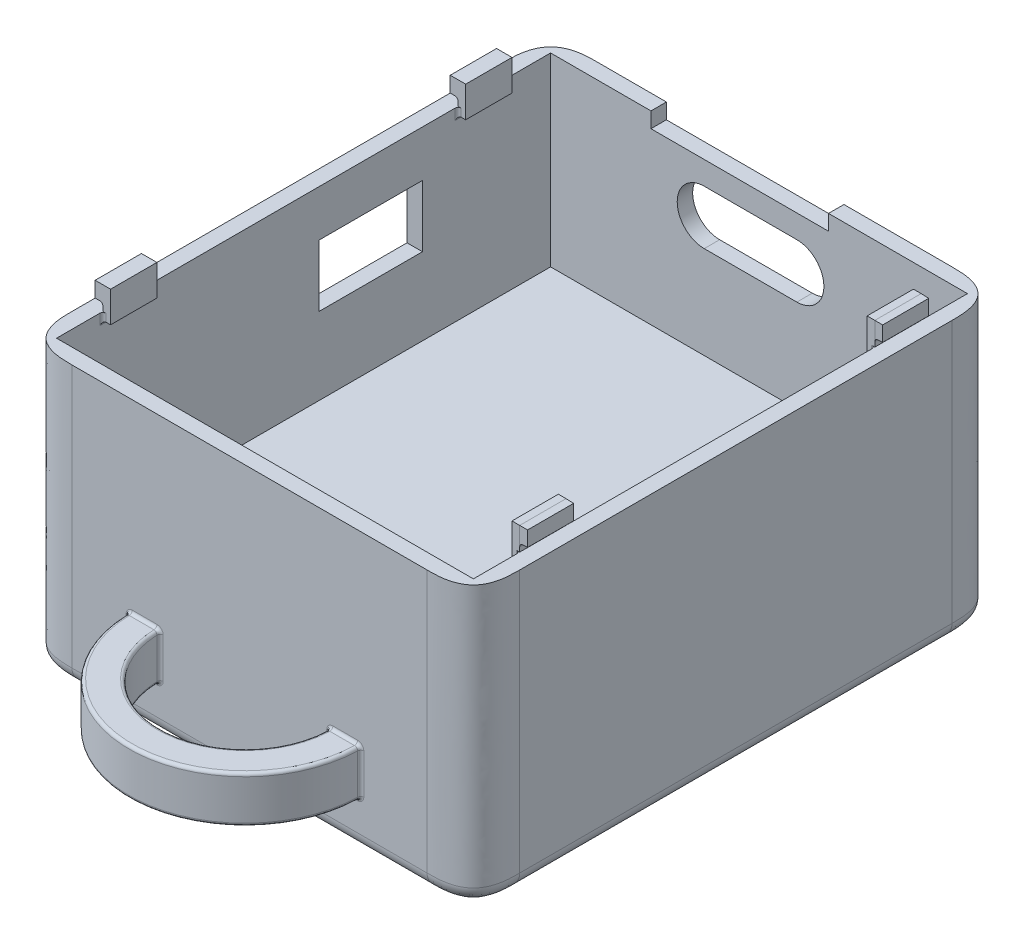
from build123d import *

# Parameters (mm, degrees)
SKETCH1_W              = 29
SKETCH1_H              = 34
BOTTOM_EXTRUDE_DEPTH   = 18
SID_CORNER_FILLET_SIZE = 3
BOTTOM_FILLET_R        = 1
SKETCH2_W              = 27
SKETCH2_H              = 32
CUT_EXTRUDE1_DEPTH     = 12
BOSS_EXTRUDE1_DEPTH    = 3
FILLET1_R              = 0.2
CUT_USB_REACH          = 157.318
SKETCH22_W             = 11.5
SKETCH22_H             = 1
SKETCH23_W             = 6.7
SKETCH23_H             = 4
CUT_BT_DEPTH           = 1
SKETCH24_W             = 3
SKETCH24_H             = 2
BOSS_CLIP_DEPTH        = 0.5
SKETCH26_W             = 3
SKETCH26_H             = 1
BOSS_CLIPEXT_DEPTH     = 0.5
BOSS_CLIPEXT_TAPER     = 1
FILLET2_R              = 0.2
LPATTERN2_COUNT        = 2
LPATTERN2_PITCH        = 23
FILLET2_OF_LPATTERN2_R = 0.2
SKETCH27_W             = 3
SKETCH27_H             = 2
BOSS_CLIP1_DEPTH       = 0.5
SKETCH28_W             = 3
SKETCH28_H             = 1
BOSS_CLIPEXT1_DEPTH    = 0.5
FILLET4_R              = 0.2
LPATTERN4_COUNT        = 2
LPATTERN4_PITCH        = 23
FILLET4_OF_LPATTERN4_R = 0.2


with BuildPart() as part:
    # Sketch1 → Bottom-Extrude (new body)
    with BuildSketch(Plane(origin=(0, 0, 0), x_dir=(1, 0, 0), z_dir=(0, 1, 0))):
        with Locations((-134.084269663, 79.775280899)):
            Rectangle(SKETCH1_W, SKETCH1_H)
    extrude(amount=BOTTOM_EXTRUDE_DEPTH)

    # Sid_Corner-Fillet
    # a fillet whose section is not a circle: 3 mm, written as the material it takes off along each edge
    with BuildSketch(Plane(origin=(-119.584269663, -7.5, -62.775280899), x_dir=(0, 0, -1), z_dir=(0, 1, 0)), Plane(origin=(-148.584269663, -7.5, -62.775280899), x_dir=(1, 0, 0), z_dir=(0, 1, 0)), Plane(origin=(-119.584269663, -7.5, -96.775280899), x_dir=(-1, 0, 0), z_dir=(0, 1, 0))) as sid_corner_fillet_piece_1:
        with BuildLine():
            add(Edge.make_bspline([(SID_CORNER_FILLET_SIZE, 0), (SID_CORNER_FILLET_SIZE * 0.831801948466, 0), (SID_CORNER_FILLET_SIZE * 0.663603896932, 0), (SID_CORNER_FILLET_SIZE * 0.292893218813, SID_CORNER_FILLET_SIZE * 0.0716919198361), (SID_CORNER_FILLET_SIZE * 0.0716919198361, SID_CORNER_FILLET_SIZE * 0.292893218813), (0, SID_CORNER_FILLET_SIZE * 0.663603896932), (0, SID_CORNER_FILLET_SIZE * 0.831801948466), (0, SID_CORNER_FILLET_SIZE)], knots=[0, 0, 0, 0, 0, 0, 0.5, 0.5, 1, 1, 1, 1, 1, 1], degree=5))
            Line((0, SID_CORNER_FILLET_SIZE), (0, 0))
            Line((0, 0), (SID_CORNER_FILLET_SIZE, 0))
        make_face()
    extrude(amount=33, mode=Mode.SUBTRACT)
    with BuildSketch(Plane(origin=(-148.584269663, -7.5, -96.775280899), x_dir=(1, 0, 0), z_dir=(0, 1, 0))) as sid_corner_fillet_piece_2:
        with BuildLine():
            add(Edge.make_bspline([(SID_CORNER_FILLET_SIZE, 0), (SID_CORNER_FILLET_SIZE * 0.831801948466, 0), (SID_CORNER_FILLET_SIZE * 0.663603896932, 0), (SID_CORNER_FILLET_SIZE * 0.292893218813, -SID_CORNER_FILLET_SIZE * 0.0716919198361), (SID_CORNER_FILLET_SIZE * 0.0716919198361, -SID_CORNER_FILLET_SIZE * 0.292893218813), (0, -SID_CORNER_FILLET_SIZE * 0.663603896932), (0, -SID_CORNER_FILLET_SIZE * 0.831801948466), (0, -SID_CORNER_FILLET_SIZE)], knots=[0, 0, 0, 0, 0, 0, 0.5, 0.5, 1, 1, 1, 1, 1, 1], degree=5))
            Line((0, -SID_CORNER_FILLET_SIZE), (0, 0))
            Line((0, 0), (SID_CORNER_FILLET_SIZE, 0))
        make_face()
    extrude(amount=33, mode=Mode.SUBTRACT)

    # Bottom-Fillet
    bottom_fillet_edges = [part.edges().sort_by_distance(p)[0] for p in [
        (-134.084269663, 0, -96.775280899),
        (-148.584269663, 0, -79.775280899),
        (-134.084269663, 0, -62.775280899),
        (-119.584269663, 0, -79.775280899),
        (-120.243279405, 0, -96.116271157),
        (-147.925259921, 0, -96.116271157),
        (-147.925259921, 0, -63.434290641),
        (-120.243279405, 0, -63.434290641),
    ]]
    fillet(bottom_fillet_edges, radius=BOTTOM_FILLET_R)

    # Sketch2 → Cut-Extrude1 (cut)
    with BuildSketch(Plane(origin=(0, 18, 0), x_dir=(1, 0, 0), z_dir=(0, 1, 0))):
        with Locations((-134.084269663, 79.775280899)):
            Rectangle(SKETCH2_W, SKETCH2_H)
    extrude(amount=-CUT_EXTRUDE1_DEPTH, mode=Mode.SUBTRACT)

    # Sketch21 → Boss-Extrude1 (add)
    with BuildSketch(Plane(origin=(0, 3, 0), x_dir=(-1, 0, 0), z_dir=(0, -1, 0))):
        with BuildLine():
            ThreePointArc((126.880155272, 62.775280899), (134.380155272, 55.275280899), (141.880155272, 62.775280899))
            Line((141.880155272, 62.775280899), (139.880155272, 62.775280899))
            ThreePointArc((139.880155272, 62.775280899), (134.380155272, 57.275280899), (128.880155272, 62.775280899))
            Line((128.880155272, 62.775280899), (126.880155272, 62.775280899))
        make_face()
    extrude(amount=-BOSS_EXTRUDE1_DEPTH)

    # Fillet1
    fillet1_edges = [part.edges().sort_by_distance(p)[0] for p in [
        (-134.380155272, 3, -57.275280899),
        (-128.880155272, 4.5, -62.775280899),
        (-140.880155272, 6, -62.775280899),
        (-139.880155272, 4.5, -62.775280899),
        (-134.380155272, 6, -55.275280899),
        (-141.880155272, 4.5, -62.775280899),
        (-127.880155272, 6, -62.775280899),
        (-126.880155272, 4.5, -62.775280899),
        (-134.380155272, 6, -57.275280899),
        (-127.880155272, 3, -62.775280899),
        (-134.380155272, 3, -55.275280899),
        (-140.880155272, 3, -62.775280899),
    ]]
    fillet(fillet1_edges, radius=FILLET1_R)

    # Sketch22 → Cut-USB (cut, up to next)
    with BuildSketch(Plane(origin=(0, 0, -96.775280899), x_dir=(-1, 0, 0), z_dir=(0, 0, -1)), mode=Mode.PRIVATE) as cut_usb_sk1:
        with BuildLine():
            Line((131.634269663, 15.5), (137.634269663, 15.5))
            ThreePointArc((137.634269663, 15.5), (139.384269663, 13.75), (137.634269663, 12))
            Line((137.634269663, 12), (131.634269663, 12))
            ThreePointArc((131.634269663, 12), (129.884269663, 13.75), (131.634269663, 15.5))
        make_face()
    cut_usb_tool1 = extrude(cut_usb_sk1.sketch, amount=-CUT_USB_REACH, mode=Mode.PRIVATE) & part.part
    # Sketch22 → Cut-USB (cut, up to next)
    with BuildSketch(Plane(origin=(0, 0, -96.775280899), x_dir=(-1, 0, 0), z_dir=(0, 0, -1)), mode=Mode.PRIVATE) as cut_usb_sk2:
        with Locations((135.334269663, 17.5)):
            Rectangle(SKETCH22_W, SKETCH22_H)
    cut_usb_tool2 = extrude(cut_usb_sk2.sketch, amount=-CUT_USB_REACH, mode=Mode.PRIVATE) & part.part
    add(cut_usb_tool1.solids().sort_by_distance((-134.63427, 13.75, -96.775281))[0], mode=Mode.SUBTRACT)
    add(cut_usb_tool2.solids().sort_by_distance((-135.33427, 17.5, -96.775281))[0], mode=Mode.SUBTRACT)

    # Sketch23 → Cut-BT (cut)
    with BuildSketch(Plane.ZY.offset(148.584269663)):
        with Locations((-84.125280899, 13)):
            Rectangle(SKETCH23_W, SKETCH23_H)
    extrude(amount=-CUT_BT_DEPTH, mode=Mode.SUBTRACT)

    # Sketch24 → Boss-Clip (add)
    with BuildSketch(Plane.ZY.offset(120.584269663)):
        with Locations((-68.275280899, 18.5)):
            Rectangle(SKETCH24_W, SKETCH24_H)
    boss_clip = extrude(amount=BOSS_CLIP_DEPTH)

    # Sketch26 → Boss-ClipExt (add)
    with BuildSketch(Plane(origin=(-120.584269663, 0, 0), x_dir=(0, 0, -1), z_dir=(1, 0, 0))):
        with Locations((68.275280899, 19)):
            Rectangle(SKETCH26_W, SKETCH26_H)
    boss_clipext = extrude(amount=BOSS_CLIPEXT_DEPTH, taper=BOSS_CLIPEXT_TAPER)

    # Fillet2
    fillet2_edges = [part.edges().sort_by_distance(p)[0] for p in [
        (-120.584269663, 17.75, -69.775280899),
        (-120.584269663, 17.75, -66.775280899),
        (-120.584269663, 17.5, -68.275280899),
        (-120.584269663, 18.5, -68.275280899),
    ]]
    fillet(fillet2_edges, radius=FILLET2_R)

    # LPattern2: Boss-Clip, Boss-ClipExt ×2
    with Locations(*[(0, 0, -i * LPATTERN2_PITCH) for i in range(1, LPATTERN2_COUNT)]):
        add(boss_clip)
        add(boss_clipext)

    # Fillet2 of LPattern2
    fillet2_of_lpattern2_edges = [part.edges().sort_by_distance(p)[0] for p in [
        (-120.584269663, 17.75, -92.775280899),
        (-120.584269663, 17.75, -89.775280899),
        (-120.584269663, 17.5, -91.275280899),
        (-120.584269663, 18.5, -91.275280899),
    ]]
    fillet(fillet2_of_lpattern2_edges, radius=FILLET2_OF_LPATTERN2_R)

    # Sketch27 → Boss-Clip1 (add)
    with BuildSketch(Plane(origin=(-147.584269663, 0, 0), x_dir=(0, 0, -1), z_dir=(1, 0, 0))):
        with Locations((68.275280899, 18.5)):
            Rectangle(SKETCH27_W, SKETCH27_H)
    boss_clip1 = extrude(amount=BOSS_CLIP1_DEPTH)

    # Sketch28 → Boss-ClipExt1 (add)
    with BuildSketch(Plane.ZY.offset(147.584269663)):
        with Locations((-68.275280899, 19)):
            Rectangle(SKETCH28_W, SKETCH28_H)
    boss_clipext1 = extrude(amount=BOSS_CLIPEXT1_DEPTH)

    # Fillet4
    fillet4_edges = [part.edges().sort_by_distance(p)[0] for p in [
        (-147.584269663, 18.5, -68.275280899),
        (-147.584269663, 17.75, -69.775280899),
        (-147.584269663, 17.5, -68.275280899),
        (-147.584269663, 17.75, -66.775280899),
    ]]
    fillet(fillet4_edges, radius=FILLET4_R)

    # LPattern4: Boss-Clip1, Boss-ClipExt1 ×2
    with Locations(*[(0, 0, -i * LPATTERN4_PITCH) for i in range(1, LPATTERN4_COUNT)]):
        add(boss_clip1)
        add(boss_clipext1)

    # Fillet4 of LPattern4
    fillet4_of_lpattern4_edges = [part.edges().sort_by_distance(p)[0] for p in [
        (-147.584269663, 18.5, -91.275280899),
        (-147.584269663, 17.75, -92.775280899),
        (-147.584269663, 17.5, -91.275280899),
        (-147.584269663, 17.75, -89.775280899),
    ]]
    fillet(fillet4_of_lpattern4_edges, radius=FILLET4_OF_LPATTERN4_R)


solid = part.part
